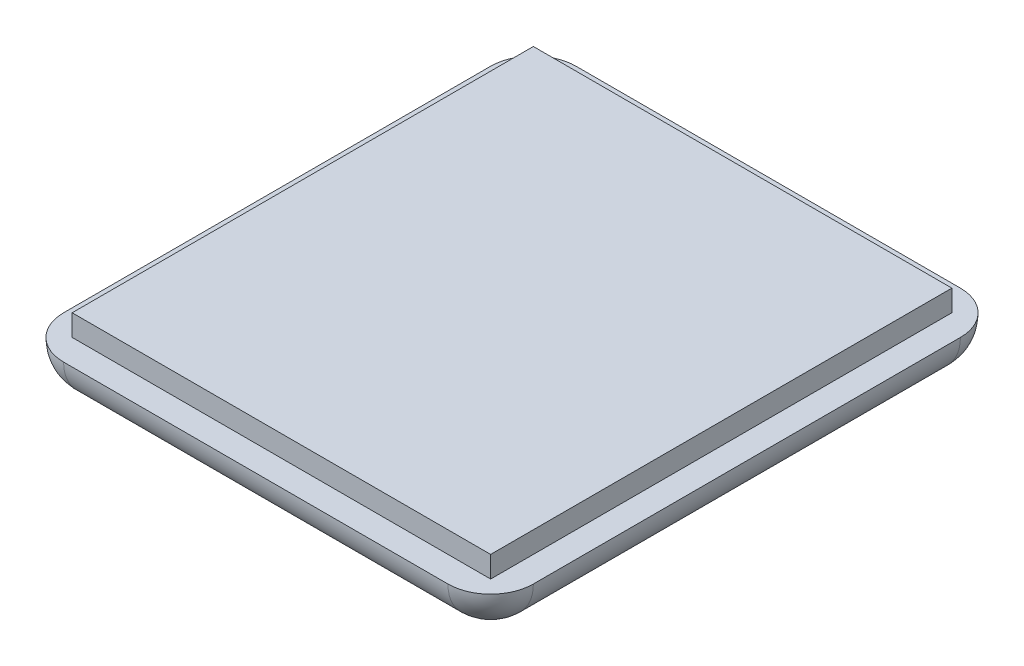
from build123d import *

# Parameters (mm, degrees)
SKETCH1_W           = 49
SKETCH1_H           = 54
BOSS_EXTRUDE1_DEPTH = 2.5
SKETCH2_W           = 55
SKETCH2_H           = 60
BOSS_EXTRUDE2_DEPTH = 5
FILLET1_R           = 5


with BuildPart() as part:
    # Sketch1 → Boss-Extrude1 (new body)
    with BuildSketch(Plane(origin=(0, 0, 0), x_dir=(1, 0, 0), z_dir=(0, 1, 0))):
        Rectangle(SKETCH1_W, SKETCH1_H)
    extrude(amount=BOSS_EXTRUDE1_DEPTH)

    # Sketch2 → Boss-Extrude2 (add)
    with BuildSketch(Plane.XZ):
        Rectangle(SKETCH2_W, SKETCH2_H)
    extrude(amount=BOSS_EXTRUDE2_DEPTH)

    # Fillet1
    fillet1_edges = [part.edges().sort_by_distance(p)[0] for p in [
        (-27.5, -2.5, 30),
        (-27.5, -2.5, -30),
        (27.5, -2.5, -30),
        (27.5, -2.5, 30),
        (-27.5, -5, 0),
        (0, -5, -30),
        (27.5, -5, 0),
        (0, -5, 30),
    ]]
    fillet(fillet1_edges, radius=FILLET1_R - 0.0001)  # a hair under: the kernel refuses the full size


solid = part.part
